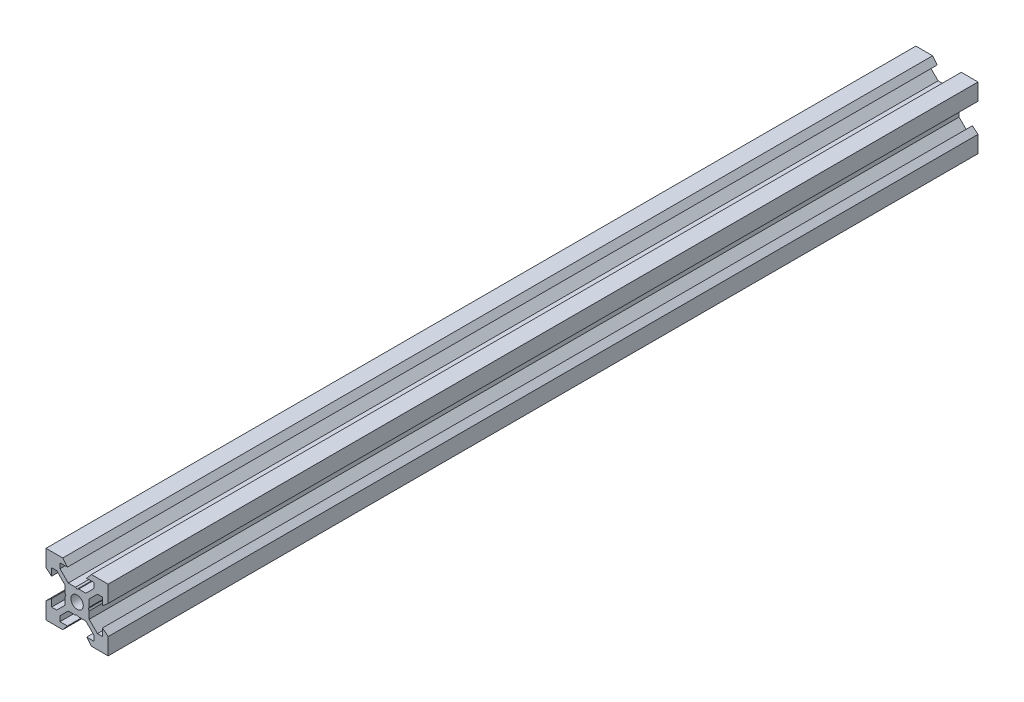
from build123d import *

# Parameters (mm, degrees)
SKETCH1_R           = 2
BOSS_EXTRUDE1_DEPTH = 140


with BuildPart() as part:
    # Sketch1 → Boss-Extrude1 (new, symmetric)
    with BuildSketch(Plane.XY):
        Polygon((10, 4.610379336), (10, 10), (4.610379336, 10), (3.1, 8.2), (5.5, 8.2), (5.5, 6.560660172), (2.839339828, 3.9), (0.519615242, 3.9), (0, 3.6), (-0.519615242, 3.9), (-2.839339828, 3.9), (-5.5, 6.560660172), (-5.5, 8.2), (-3.1, 8.2), (-4.610379336, 10), (-10, 10), (-10, 4.610379336), (-8.2, 3.1), (-8.2, 5.5), (-6.560660172, 5.5), (-3.9, 2.839339828), (-3.9, 0.519615242), (-3.6, 0), (-3.9, -0.519615242), (-3.9, -2.839339828), (-6.560660172, -5.5), (-8.2, -5.5), (-8.2, -3.1), (-10, -4.610379336), (-10, -10), (-4.610379336, -10), (-3.1, -8.2), (-5.5, -8.2), (-5.5, -6.560660172), (-2.839339828, -3.9), (-0.519615242, -3.9), (0, -3.6), (0.519615242, -3.9), (2.839339828, -3.9), (5.5, -6.560660172), (5.5, -8.2), (3.1, -8.2), (4.610379336, -10), (10, -10), (10, -4.610379336), (8.2, -3.1), (8.2, -5.5), (6.560660172, -5.5), (3.9, -2.839339828), (3.9, -0.519615242), (3.6, 0), (3.9, 0.519615242), (3.9, 2.839339828), (6.560660172, 5.5), (8.2, 5.5), (8.2, 3.1), align=None)
        Circle(SKETCH1_R, mode=Mode.SUBTRACT)
    extrude(amount=BOSS_EXTRUDE1_DEPTH, both=True)


solid = part.part
